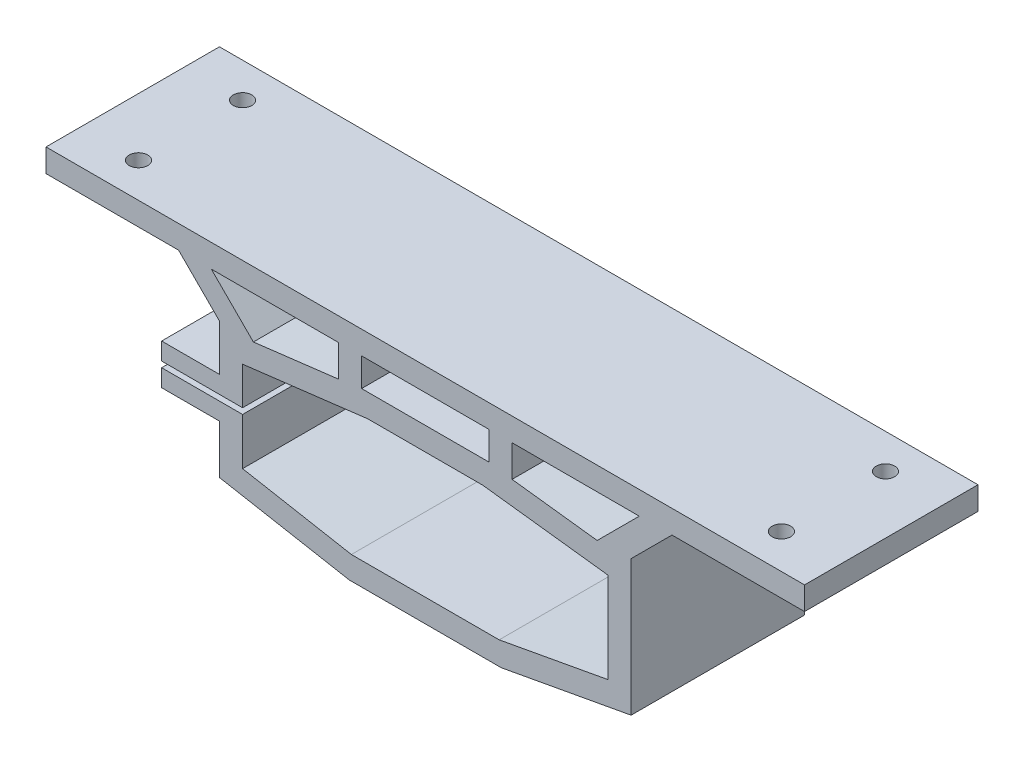
from build123d import *

# Parameters (mm, degrees)
EXTRUDE1_DEPTH      = 20
EXTRUDE1_DEPTH_BACK = 10
SKETCH2_W           = 22.028427124
SKETCH2_H           = 4.9
SKETCH3_R           = 1.6
CUT_EXTRUDE1_DEPTH  = 20
SKETCH4_R           = 2.15
CUT_EXTRUDE2_DEPTH  = 15


with BuildPart() as part:
    # Sketch2 → Extrude1 (new, two sides: drawn at the far end of the back side and taken through both)
    with BuildSketch(Plane.XY.offset(70).offset(-EXTRUDE1_DEPTH_BACK)):
        Polygon((31.6, 1.959185913), (31.6, -13.690519995), (12.781818432, -17.14052), (-12.781818445, -17.14052), (-31.6, -13.690519995), (-31.6, -5.571067812), (-45.6, -5.571067812), (-45.6, -8.571067812), (-35.6, -8.571067812), (-35.6, -17.023853319), (-13.145454814, -21.14052), (13.145454801, -21.14052), (35.6, -17.023853319), (35.6, 6.428932188), (42.671067812, 13.5), (65.6, 13.5), (65.6, 17.5), (-65.6, 17.5), (-65.6, 13.5), (-42.671067812, 13.5), (-35.6, 6.428932188), (-35.6, -1.571067812), (-45.6, -1.571067812), (-45.6, -4.571067812), (-31.6, -4.571067812), (-31.6, 1.959185913), (-9.945324486, 4.6), (9.945324486, 4.6), align=None)
        Polygon((37.014213562, 13.5), (29.730964998, 6.216751436), (15.014213562, 8.011477221), (15.014213562, 13.5), align=None, mode=Mode.SUBTRACT)
        with Locations((0, 11.05)):
            Rectangle(SKETCH2_W, SKETCH2_H, mode=Mode.SUBTRACT)
        Polygon((-15.014213562, 13.5), (-15.014213562, 8.011477221), (-29.730964998, 6.216751436), (-37.014213562, 13.5), align=None, mode=Mode.SUBTRACT)
    extrude(amount=EXTRUDE1_DEPTH + EXTRUDE1_DEPTH_BACK)

    # Sketch3 → Cut-Extrude1 (cut)
    with BuildSketch(Plane.XZ.offset(-13.5)):
        with Locations((-55.6, 84)):
            Circle(SKETCH3_R)
        with Locations((-55.6, 66)):
            Circle(SKETCH3_R)
        with Locations((55.6, 84)):
            Circle(SKETCH3_R)
        with Locations((55.6, 66)):
            Circle(SKETCH3_R)
    extrude(amount=-CUT_EXTRUDE1_DEPTH, mode=Mode.SUBTRACT)

    # Sketch4 → Cut-Extrude2 (cut)
    with BuildSketch(Plane.XZ.offset(8.571067812)):
        with Locations((-41.6, 75)):
            Circle(SKETCH4_R)
    extrude(amount=-CUT_EXTRUDE2_DEPTH, mode=Mode.SUBTRACT)


solid = part.part
